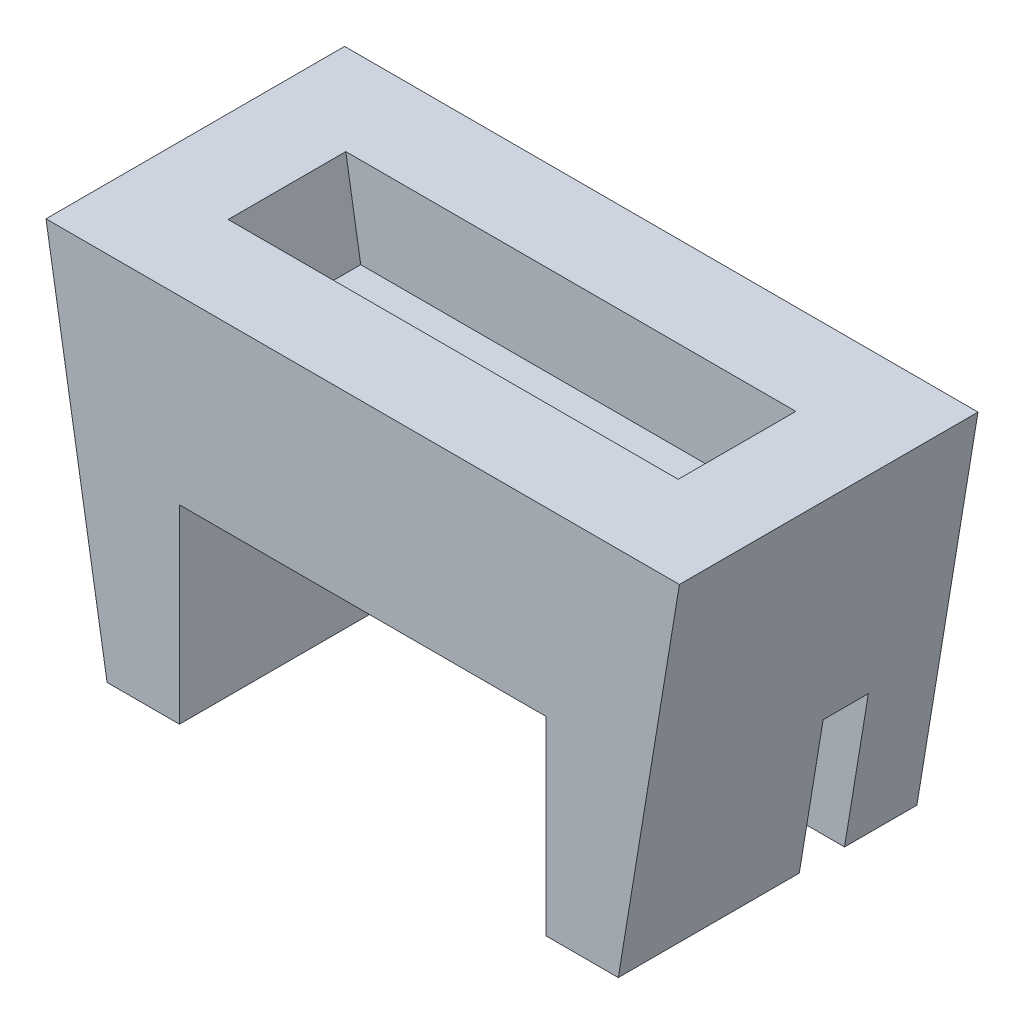
from build123d import *

# Parameters (mm, degrees)
RESSALTO_EXTRUS_O1_DEPTH = 30
RESSALTO_EXTRUS_O2_DEPTH = 3
CASCA1_START             = 7
CASCA1_DEPTH             = 13
ESBO_O3_W                = 5
ESBO_O3_H                = 20
CORTE_EXTRUS_O1_DEPTH    = 67.283953563


# Read off the part's stored shape, not the designer's step: Casca1
with BuildPart() as part:
    # Esboço1 → Ressalto-extrusão1 (new body)
    with BuildSketch(Plane.XY):
        Polygon((-35, 20), (35, 20), (28.25, -21), (20.25, -21), (20.25, 0), (-20.25, 0), (-20.25, -21), (-28.25, -21), align=None)
    extrude(amount=RESSALTO_EXTRUS_O1_DEPTH)

    # Esboço2 → Ressalto-extrusão2 (add)
    with BuildSketch(Plane(origin=(0, 0, 0), x_dir=(-1, 0, 0), z_dir=(0, 0, -1))):
        Polygon((-35, 20), (35, 20), (28.25, -21), (-28.25, -21), align=None)
    extrude(amount=RESSALTO_EXTRUS_O2_DEPTH)

    # Casca1 outline → Casca1 (cut)
    with BuildSketch(Plane.XY.offset(CASCA1_START)):
        Polygon((-24.865384062, 20), (-23.219042598, 10), (23.219042598, 10), (24.865384062, 20), align=None)
    extrude(amount=CASCA1_DEPTH, mode=Mode.SUBTRACT)

    # Esboço3 → Corte-extrusão1 (cut, through all)
    with BuildSketch(Plane.ZY.offset(-20.25)):
        with Locations((7.5, -15)):
            Rectangle(ESBO_O3_W, ESBO_O3_H)
    extrude(amount=-CORTE_EXTRUS_O1_DEPTH, mode=Mode.SUBTRACT)


solid = part.part
